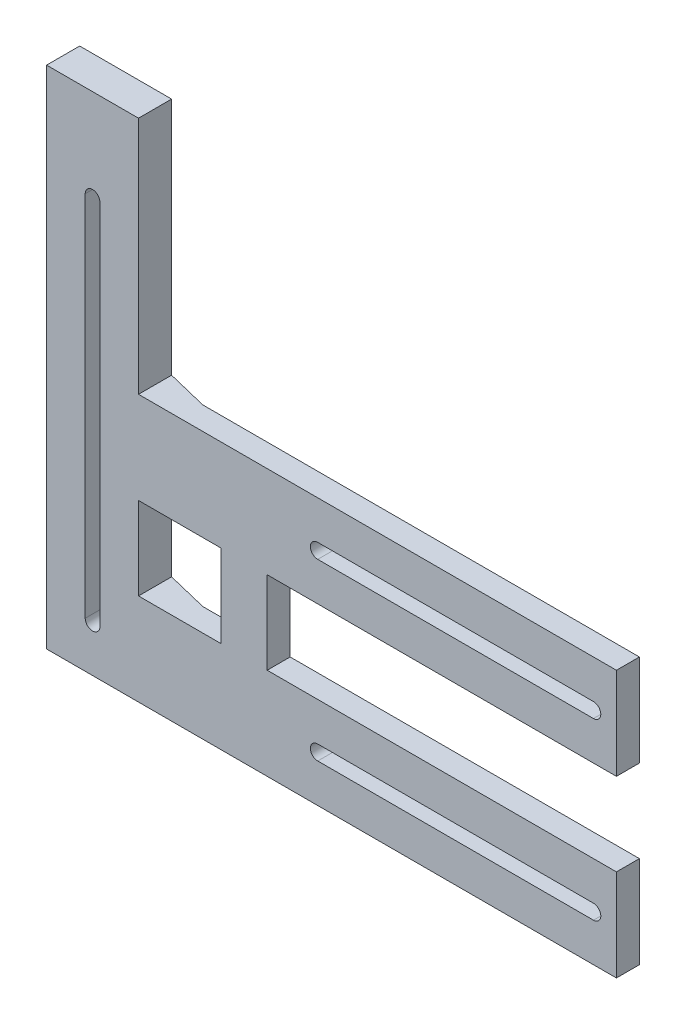
from build123d import *

# Parameters (mm, degrees)
SKETCH_1_W                  = 76
SKETCH_1_H                  = 20
SKETCH_1_W_2                = 18
SKETCH_1_W_3                = 10
SKETCH_1_H_2                = 18
SKETCH_1_W_4                = 20
SKETCH_1_H_3                = 52.041621827
EXTRUDE_1_DEPTH             = 5
HOLE_WIZARD_3_2_3_2_1_DEPTH = 5
SKETCH_8_W                  = 20
SKETCH_8_H                  = 110.041621827
EXTRUDE_2_DEPTH             = 2.2
HOLE_START                  = -2.2
HOLE_WIZARD_3_2_3_2_3_DEPTH = 7.2
RIB_1_REACH                 = 147.55
SKETCH_11_WALL_W            = 302.364540162
SKETCH_11_WALL_H            = 20
RIB_2_REACH                 = 113.533
SKETCH_12_WALL_W            = 234.330707354
SKETCH_12_WALL_H            = 20


# Read off the part's stored shape, not the designer's step: Ø3.2 (3.2) 直径槽口1, Ø3.2 (3.2) 直径槽口3
with BuildPart() as part:
    # 草图1 → 凸台-拉伸1 (new body)
    with BuildSketch(Plane.XY):
        with Locations((-9.134530028, -25.635533007)):
            Rectangle(SKETCH_1_W, SKETCH_1_H)
        with Locations((-66.134530028, -25.635533007)):
            Rectangle(SKETCH_1_W_2, SKETCH_1_H)
        with Locations((-52.134530028, -25.635533007)):
            Rectangle(SKETCH_1_W_3, SKETCH_1_H)
        with Locations((-66.134530028, 12.364466993)):
            Rectangle(SKETCH_1_W_2, SKETCH_1_H)
        with Locations((-9.134530028, 12.364466993)):
            Rectangle(SKETCH_1_W, SKETCH_1_H)
        with Locations((-52.134530028, 12.364466993)):
            Rectangle(SKETCH_1_W_3, SKETCH_1_H)
        with Locations((-52.134530028, -6.635533007)):
            Rectangle(SKETCH_1_W_3, SKETCH_1_H_2)
        with Locations((-85.134530028, 12.364466993)):
            Rectangle(SKETCH_1_W_4, SKETCH_1_H)
        with Locations((-85.134530028, -6.635533007)):
            Rectangle(SKETCH_1_W_4, SKETCH_1_H_2)
        with Locations((-85.134530028, -25.635533007)):
            Rectangle(SKETCH_1_W_4, SKETCH_1_H)
        with Locations((-85.134530028, 48.385277907)):
            Rectangle(SKETCH_1_W_4, SKETCH_1_H_3)
    extrude(amount=EXTRUDE_1_DEPTH)

    # Ø3.2 (3.2) 直径槽口1 outline → Ø3.2 (3.2) 直径槽口1 (cut)
    with BuildSketch(Plane.XY):
        with BuildLine():
            Line((-36.134530028, 10.764466993), (23.865469972, 10.764466993))
            ThreePointArc((23.865469972, 10.764466993), (25.465469972, 12.364466993), (23.865469972, 13.964466993))
            Line((23.865469972, 13.964466993), (-36.134530028, 13.964466993))
            ThreePointArc((-36.134530028, 13.964466993), (-37.734530028, 12.364466993), (-36.134530028, 10.764466993))
        make_face()
        with BuildLine():
            Line((-36.134530028, -27.235533007), (23.865469972, -27.235533007))
            ThreePointArc((23.865469972, -27.235533007), (25.465469972, -25.635533007), (23.865469972, -24.035533007))
            Line((23.865469972, -24.035533007), (-36.134530028, -24.035533007))
            ThreePointArc((-36.134530028, -24.035533007), (-37.734530028, -25.635533007), (-36.134530028, -27.235533007))
        make_face()
    extrude(amount=HOLE_WIZARD_3_2_3_2_1_DEPTH, mode=Mode.SUBTRACT)

    # 草图8 → 凸台-拉伸2 (add)
    with BuildSketch(Plane(origin=(0, 0, 0), x_dir=(-1, 0, 0), z_dir=(0, 0, -1))):
        with Locations((85.134530028, 19.385277907)):
            Rectangle(SKETCH_8_W, SKETCH_8_H)
    extrude(amount=EXTRUDE_2_DEPTH)

    # Ø3.2 (3.2) 直径槽口3 outline → Ø3.2 (3.2) 直径槽口3 (cut)
    with BuildSketch(Plane.XY.offset(HOLE_START)):
        with BuildLine():
            Line((-83.534530028, -25.635533007), (-83.534530028, 54.364466993))
            ThreePointArc((-83.534530028, 54.364466993), (-85.134530028, 55.964466993), (-86.734530028, 54.364466993))
            Line((-86.734530028, 54.364466993), (-86.734530028, -25.635533007))
            ThreePointArc((-86.734530028, -25.635533007), (-85.134530028, -27.235533007), (-83.534530028, -25.635533007))
        make_face()
    extrude(amount=HOLE_WIZARD_3_2_3_2_3_DEPTH, mode=Mode.SUBTRACT)

    # 草图11 wall → 筋1 (add, up to next)
    with BuildSketch(Plane(origin=(-70.634530028, -35.635533007, -1.1), x_dir=(0.971399006497, 0, 0.237453090477), z_dir=(-0.237453090477, 0, 0.971399006497)), mode=Mode.PRIVATE) as rib_1_sk1:
        with Locations((0, 10)):
            Rectangle(SKETCH_11_WALL_W, SKETCH_11_WALL_H)
    rib_1_tool1 = extrude(rib_1_sk1.sketch, amount=RIB_1_REACH, mode=Mode.PRIVATE) - part.part
    add(rib_1_tool1.solids().sort_by_distance((-70.634530028, -35.635533007, -1.1))[0])

    # 草图12 wall → 筋2 (add, up to next)
    with BuildSketch(Plane(origin=(-70.634530028, 22.364466993, -1.1), x_dir=(0.971399006497, 0, 0.237453090477), z_dir=(0.237453090477, 0, -0.971399006497)), mode=Mode.PRIVATE) as rib_2_sk1:
        with Locations((0, 10)):
            Rectangle(SKETCH_12_WALL_W, SKETCH_12_WALL_H)
    rib_2_tool1 = extrude(rib_2_sk1.sketch, amount=-RIB_2_REACH, mode=Mode.PRIVATE) - part.part
    add(rib_2_tool1.solids().sort_by_distance((-70.634530028, 22.364466993, -1.1))[0])


solid = part.part
